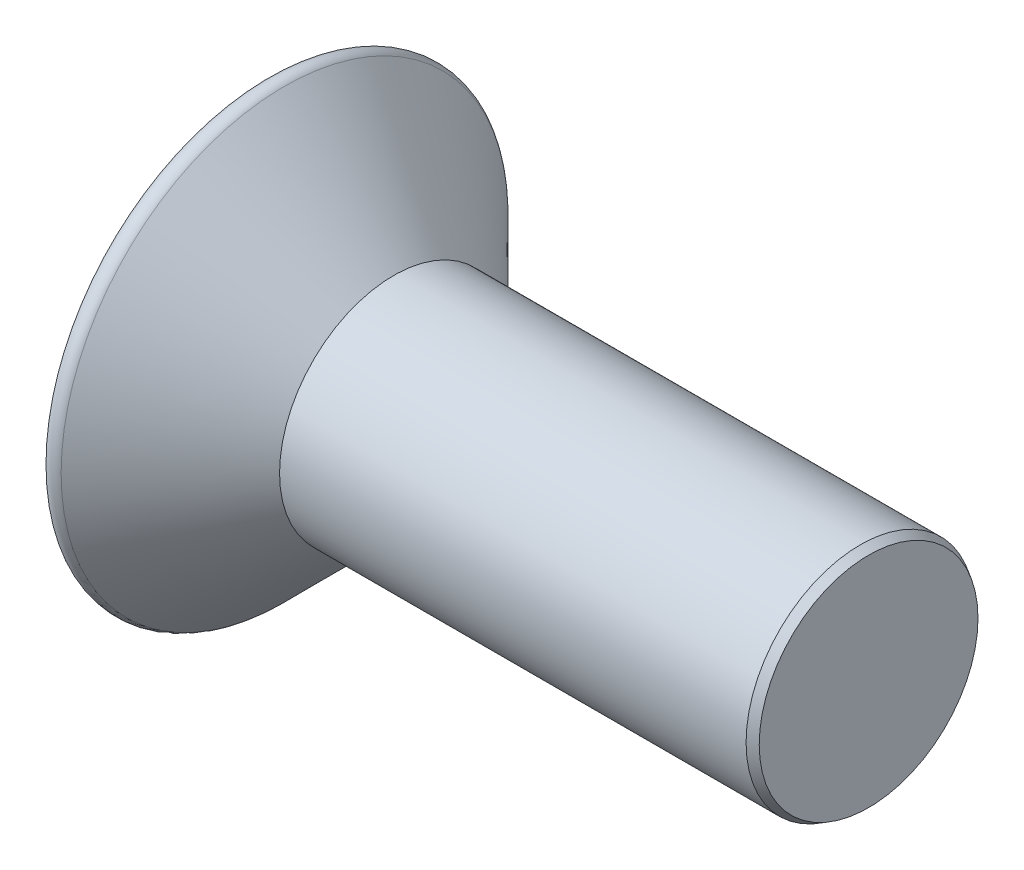
from build123d import *

# Parameters (mm, degrees)
CHAMFER1_SIZE      = 0.2
CHAMFER1_SIZE2     = 0.346410162
CUT_EXTRUDE1_DEPTH = 3.775
CUT_EXTRUDE1_TAPER = 6


with BuildPart() as part:
    # Sketch1 → Revolve1 (revolve)
    with BuildSketch(Plane.XY):
        with BuildLine():
            Line((-7.55, 0), (19.75, 0))
            Line((19.75, 0), (19.75, 4.75))
            Line((19.75, 4.75), (0, 4.75))
            Line((0, 4.75), (-4.542533916, 9.292533916))
            ThreePointArc((-4.542533916, 9.292533916), (-4.922708454, 9.418097537), (-5.25, 9.187491497))
            ThreePointArc((-5.25, 9.187491497), (-6.966262844, 4.735504197), (-7.55, 0))
        make_face()
    revolve(axis=Axis((0, 0, 0), (1, 0, 0)))

    # Chamfer1
    chamfer1_edges = [part.edges().sort_by_distance(p)[0] for p in [
        (19.75, -4.75, 0),
    ]]
    chamfer1_side = [part.faces().sort_by_distance(p)[0] for p in [
        (19.75, 0, 0),
    ]]
    chamfer(chamfer1_edges, length=CHAMFER1_SIZE, length2=CHAMFER1_SIZE2, reference=chamfer1_side[0])

    # Sketch3 → Cut-Extrude1 (cut)
    with BuildSketch(Plane(origin=(-7.55, 0, 0), x_dir=(0, 0, -1), z_dir=(1, 0, 0))):
        Polygon((-1.04, 5.2), (-0.693333333, 3.466666667), (-1.708443786, 1.708443786), (-3.466666667, 0.693333333), (-5.2, 1.04), (-5.2, -1.04), (-3.466666667, -0.693333333), (-1.708443786, -1.708443786), (-0.693333333, -3.466666667), (-1.04, -5.2), (1.04, -5.2), (0.693333333, -3.466666667), (1.708443786, -1.708443786), (3.466666667, -0.693333333), (5.2, -1.04), (5.2, 1.04), (3.466666667, 0.693333333), (1.708443786, 1.708443786), (0.693333333, 3.466666667), (1.04, 5.2), align=None)
    extrude(amount=CUT_EXTRUDE1_DEPTH, taper=CUT_EXTRUDE1_TAPER, mode=Mode.SUBTRACT)


solid = part.part
